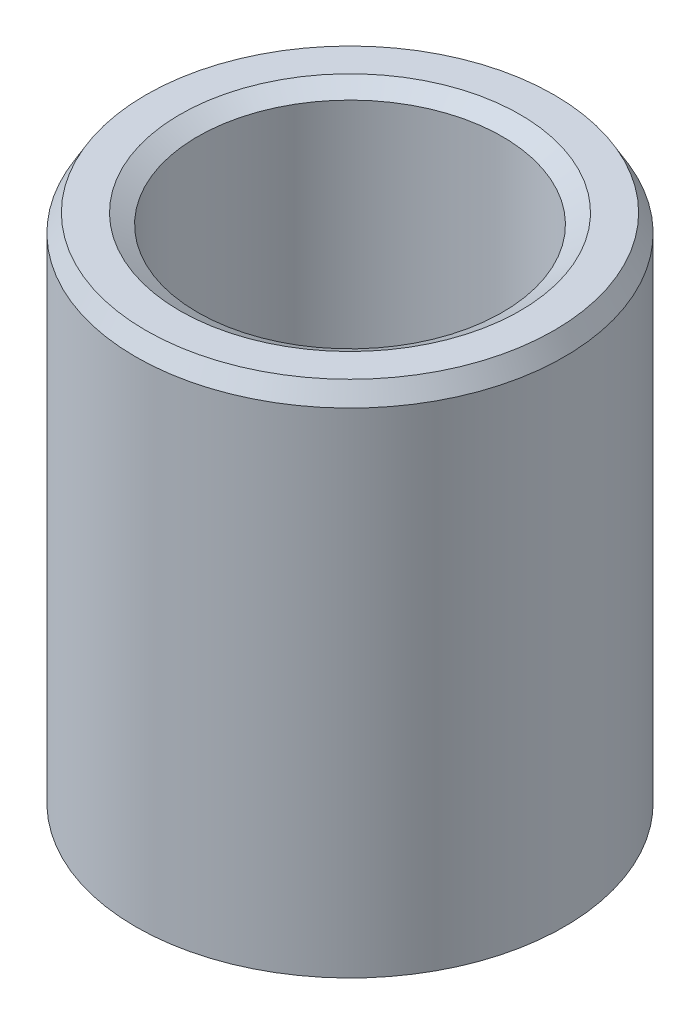
from build123d import *
from OCP.BRepFilletAPI import BRepFilletAPI_MakeChamfer

# Parameters (mm, degrees)
SKETCH1_R           = 42.5
BOSS_EXTRUDE1_DEPTH = 103.410292719
SKETCH2_R           = 30.209244391
CUT_EXTRUDE1_DEPTH  = 120.608480637
CHAMFER1_SIZE       = 3.514397417
CHAMFER1_SIZE2      = 2.029038294


with BuildPart() as part:
    # Sketch1 → Boss-Extrude1 (new body)
    with BuildSketch(Plane(origin=(0, 0, 0), x_dir=(1, 0, 0), z_dir=(0, 1, 0))):
        Circle(SKETCH1_R)
    extrude(amount=BOSS_EXTRUDE1_DEPTH)

    # Sketch2 → Cut-Extrude1 (cut, through all)
    with BuildSketch(Plane(origin=(0, 0, 0), x_dir=(1, 0, 0), z_dir=(0, 1, 0))):
        Circle(SKETCH2_R)
    extrude(amount=CUT_EXTRUDE1_DEPTH, mode=Mode.SUBTRACT)

    # Chamfer1: one chamfer whose edges measure the first distance from different faces: ONE call of the kernel's chamfer builder (chamfer() names one face for all edges)
    chamfer1_edges_1 = [part.edges().sort_by_distance(p)[0] for p in [
        (-30.209244391, 103.410292719, 0),
    ]]
    chamfer1_side_1 = [part.faces().sort_by_distance(p)[0] for p in [
        (-41.297918472, 103.410292719, 0),
    ]]
    chamfer1_edges_2 = [part.edges().sort_by_distance(p)[0] for p in [
        (-30.209244391, 0, 0),
    ]]
    chamfer1_side_2 = [part.faces().sort_by_distance(p)[0] for p in [
        (-30.209244391, 51.70514636, 0),
    ]]
    chamfer1_edges_3 = [part.edges().sort_by_distance(p)[0] for p in [
        (-42.5, 0, 0),
    ]]
    chamfer1_side_3 = [part.faces().sort_by_distance(p)[0] for p in [
        (-41.297918472, 0, 0),
    ]]
    chamfer1_edges_4 = [part.edges().sort_by_distance(p)[0] for p in [
        (-42.5, 103.410292719, 0),
    ]]
    chamfer1_side_4 = [part.faces().sort_by_distance(p)[0] for p in [
        (-42.5, 51.70514636, 0),
    ]]
    chamfer1 = BRepFilletAPI_MakeChamfer(part.part.solid().wrapped)
    for e in chamfer1_edges_1:
        chamfer1.Add(CHAMFER1_SIZE, CHAMFER1_SIZE2, e.wrapped, chamfer1_side_1[0].wrapped)  # the first distance lies on this face
    for e in chamfer1_edges_2:
        chamfer1.Add(CHAMFER1_SIZE, CHAMFER1_SIZE2, e.wrapped, chamfer1_side_2[0].wrapped)  # the first distance lies on this face
    for e in chamfer1_edges_3:
        chamfer1.Add(CHAMFER1_SIZE, CHAMFER1_SIZE2, e.wrapped, chamfer1_side_3[0].wrapped)  # the first distance lies on this face
    for e in chamfer1_edges_4:
        chamfer1.Add(CHAMFER1_SIZE, CHAMFER1_SIZE2, e.wrapped, chamfer1_side_4[0].wrapped)  # the first distance lies on this face
    add(Compound.cast(chamfer1.Shape()), mode=Mode.REPLACE)


solid = part.part
